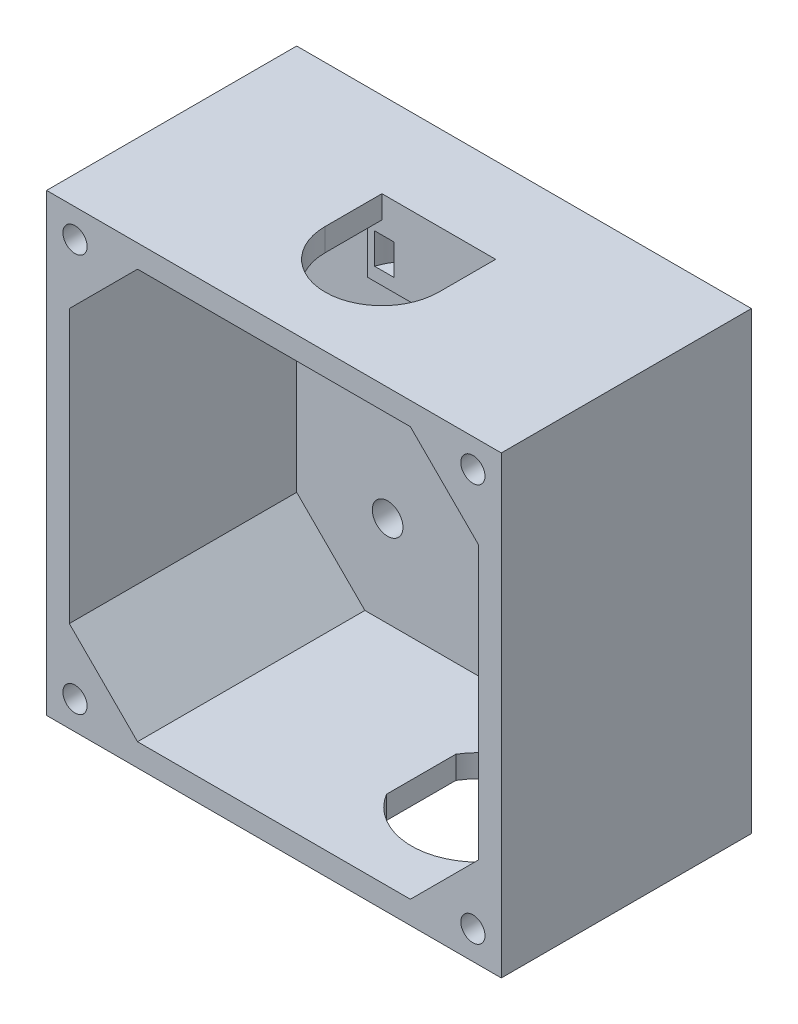
from build123d import *

# Parameters (mm, degrees)
SKETCH1_W                 = 50.8
SKETCH1_H                 = 50.8
BOSS_EXTRUDE1_DEPTH       = 2.54
SKETCH2_W                 = 50.8
SKETCH2_H                 = 50.8
SKETCH2_W_2               = 45.72
SKETCH2_H_2               = 45.72
BOSS_EXTRUDE2_DEPTH       = 25.4
CUT_EXTRUDE1_REACH        = 79.084
CUT_EXTRUDE3_REACH        = 79.084
BOSS_EXTRUDE3_DEPTH       = 25.4
CUT_EXTRUDE4_START        = -2.54
SKETCH8_W                 = 22.225
SKETCH8_H                 = 7.62
CUT_EXTRUDE4_DEPTH        = 12.7
LOFT1_START               = 36.295124673
LOFT1_DEPTH               = 4.399409051
F_6_32_TAPPED_HOLE1_D     = 2.7051
F_6_32_TAPPED_HOLE1_DEPTH = 12.7
F_6_32_TAPPED_HOLE1_TIP   = 0.81269403
F_6_CLEARANCE_HOLE1_D     = 3.429
SKETCH15_W                = 15.875
SKETCH15_H                = 6.35
BOSS_EXTRUDE5_DEPTH       = 6.985
CUT_EXTRUDE5_START        = -3.175
SKETCH16_R                = 7.62
SKETCH16_R_2              = 5.588
CUT_EXTRUDE5_DEPTH        = 1.7145


with BuildPart() as part:
    # Sketch1 → Boss-Extrude1 (new body)
    with BuildSketch(Plane.XY):
        with Locations((25.4, 25.4)):
            Rectangle(SKETCH1_W, SKETCH1_H)
    extrude(amount=BOSS_EXTRUDE1_DEPTH)

    # Sketch2 → Boss-Extrude2 (add)
    with BuildSketch(Plane.XY.offset(2.54)):
        with Locations((25.4, 25.4)):
            Rectangle(SKETCH2_W, SKETCH2_H)
        with Locations((25.4, 25.4)):
            Rectangle(SKETCH2_W_2, SKETCH2_H_2, mode=Mode.SUBTRACT)
    extrude(amount=BOSS_EXTRUDE2_DEPTH)

    # Sketch3 → Cut-Extrude1 (cut, up to next)
    with BuildSketch(Plane.XZ, mode=Mode.PRIVATE) as cut_extrude1_sk1:
        with BuildLine():
            Line((29.1465, 19.114540844), (29.1465, 11.365459156))
            ThreePointArc((29.1465, 11.365459156), (35.56, 7.747), (41.9735, 11.365459156))
            Line((41.9735, 11.365459156), (41.9735, 19.114540844))
            ThreePointArc((41.9735, 19.114540844), (35.56, 22.733), (29.1465, 19.114540844))
        make_face()
    cut_extrude1_tool1 = extrude(cut_extrude1_sk1.sketch, amount=-CUT_EXTRUDE1_REACH, mode=Mode.PRIVATE) & part.part
    add(cut_extrude1_tool1.solids().sort_by_distance((35.56, 0, 15.24))[0], mode=Mode.SUBTRACT)

    # Sketch4 → Cut-Extrude3 (cut, up to next)
    with BuildSketch(Plane(origin=(0, 50.8, 0), x_dir=(1, 0, 0), z_dir=(0, 1, 0)), mode=Mode.PRIVATE) as cut_extrude3_sk1:
        with BuildLine():
            Line((31.75, -15.875), (31.75, -9.525))
            Line((31.75, -9.525), (19.05, -9.525))
            Line((19.05, -9.525), (19.05, -15.875))
            ThreePointArc((19.05, -15.875), (25.4, -22.225), (31.75, -15.875))
        make_face()
    cut_extrude3_tool1 = extrude(cut_extrude3_sk1.sketch, amount=-CUT_EXTRUDE3_REACH, mode=Mode.PRIVATE) & part.part
    add(cut_extrude3_tool1.solids().sort_by_distance((25.4, 50.8, 15.282228))[0], mode=Mode.SUBTRACT)

    # Sketch6 → Boss-Extrude3 (add)
    with BuildSketch(Plane.XY.offset(2.54)):
        Polygon((2.54, 48.26), (10.16, 48.26), (2.54, 40.64), align=None)
        Polygon((48.26, 48.26), (48.26, 40.64), (40.64, 48.26), align=None)
        Polygon((48.26, 2.54), (48.26, 10.16), (40.64, 2.54), align=None)
        Polygon((2.54, 2.54), (2.54, 10.16), (10.16, 2.54), align=None)
    extrude(amount=BOSS_EXTRUDE3_DEPTH)

    # Sketch8 → Cut-Extrude4 (cut)
    with BuildSketch(Plane(origin=(50.8, 0, 0), x_dir=(0, 0, -1), z_dir=(1, 0, 0)).offset(CUT_EXTRUDE4_START)):
        with Locations((-13.6525, 6.35)):
            Rectangle(SKETCH8_W, SKETCH8_H)
    extrude(amount=-CUT_EXTRUDE4_DEPTH, mode=Mode.SUBTRACT)

    # Loft1: read off the stored shape, not the designer's step
    # Loft1 outline → Loft1 (add)
    with BuildSketch(Plane(origin=(0, 0, 0), x_dir=(0.8164965809277258, 0.40824829046386313, -0.40824829046386313), z_dir=(0.5773502691896258, -0.5773502691896258, 0.5773502691896258)).offset(LOFT1_START)):
        Polygon((33.441658713, 24.695704333), (24.109102793, 19.30755066), (33.441658713, 13.919396988), align=None)
    extrude(amount=LOFT1_DEPTH)

    # #6-32 Tapped Hole1
    with Locations(Plane.XY.offset(27.94)):
        with Locations((47.625, 3.175), (47.625, 47.625), (3.175, 47.625), (3.175, 3.175)):
            Hole(F_6_32_TAPPED_HOLE1_D / 2, depth=F_6_32_TAPPED_HOLE1_DEPTH)
            with Locations((0, 0, -(F_6_32_TAPPED_HOLE1_DEPTH + F_6_32_TAPPED_HOLE1_TIP / 2))):  # 118° drill point
                Cone(0, F_6_32_TAPPED_HOLE1_D / 2, F_6_32_TAPPED_HOLE1_TIP, mode=Mode.SUBTRACT)

    # #6 Clearance Hole1 (through all)
    with Locations(Plane.XY.offset(2.54)):
        with Locations((12.7, 38.1), (38.1, 38.1), (38.1, 12.7), (12.7, 12.7)):
            Hole(F_6_CLEARANCE_HOLE1_D / 2)

    # Sketch15 → Boss-Extrude5 (add)
    with BuildSketch(Plane.XY.offset(2.54)):
        with Locations((25.4, 45.085)):
            Rectangle(SKETCH15_W, SKETCH15_H)
    extrude(amount=BOSS_EXTRUDE5_DEPTH)

    # Sketch16 → Cut-Extrude5 (cut, symmetric)
    with BuildSketch(Plane.XZ.offset(-41.91).offset(CUT_EXTRUDE5_START)):
        with Locations((25.4, 12.065)):
            Circle(SKETCH16_R)
        with Locations((25.4, 12.065)):
            Circle(SKETCH16_R_2, mode=Mode.SUBTRACT)
    extrude(amount=CUT_EXTRUDE5_DEPTH, both=True, mode=Mode.SUBTRACT)


solid = part.part
